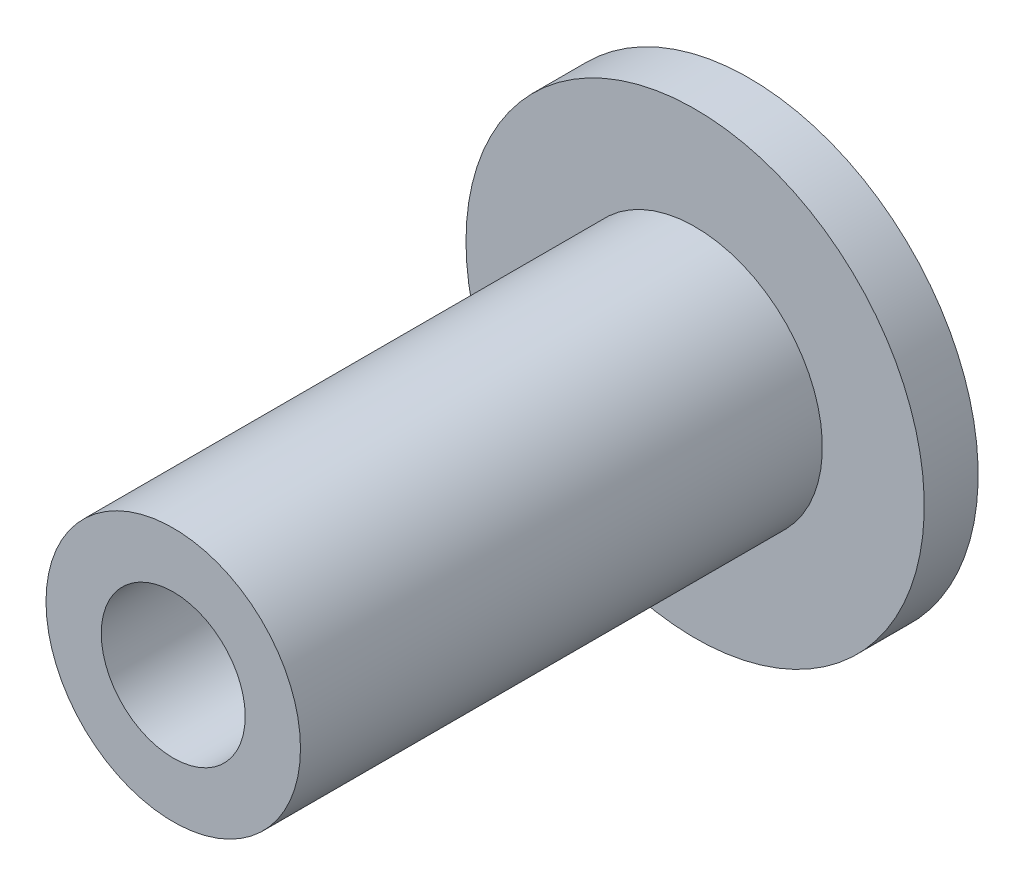
from build123d import *
from build123d.topology import SkipClean

# Parameters (mm, degrees)
SKETCH2_R           = 5.9944
SKETCH2_R_2         = 3.3909
BOSS_EXTRUDE1_DEPTH = 10.033
SKETCH3_R           = 2.4384
CUT_EXTRUDE1_DEPTH  = 23.918894468


with BuildPart() as part:
    # Sketch2 → Boss-Extrude1 (new body)
    with BuildSketch(Plane.XY):
        Circle(SKETCH2_R)
        Circle(SKETCH2_R_2, mode=Mode.SUBTRACT)
    extrude(amount=BOSS_EXTRUDE1_DEPTH)

    # Sketch6 → Revolve1 (revolve)
    with SkipClean():  # the faces are left unmerged after this step: merging them gives an invalid solid
        with BuildSketch(Plane(origin=(0, 0, 0), x_dir=(1, 0, 0), z_dir=(0, 1, 0))):
            Polygon((-5.9944, 0), (-5.9944, 14.5542), (-10.795, 14.5542), (-10.795, 17.0942), (-3.3909, 17.0942), (-3.3909, 0), align=None)
        revolve(axis=Axis((0, 0, 0), (0, 0, 1)))

    # Sketch3 → Cut-Extrude1 (cut, through all)
    with SkipClean():  # the faces are left unmerged after this step: merging them gives an invalid solid
        with BuildSketch(Plane.XZ):
            with Locations((0, 1.3462)):
                Circle(SKETCH3_R)
        extrude(amount=CUT_EXTRUDE1_DEPTH, mode=Mode.SUBTRACT)


solid = part.part
